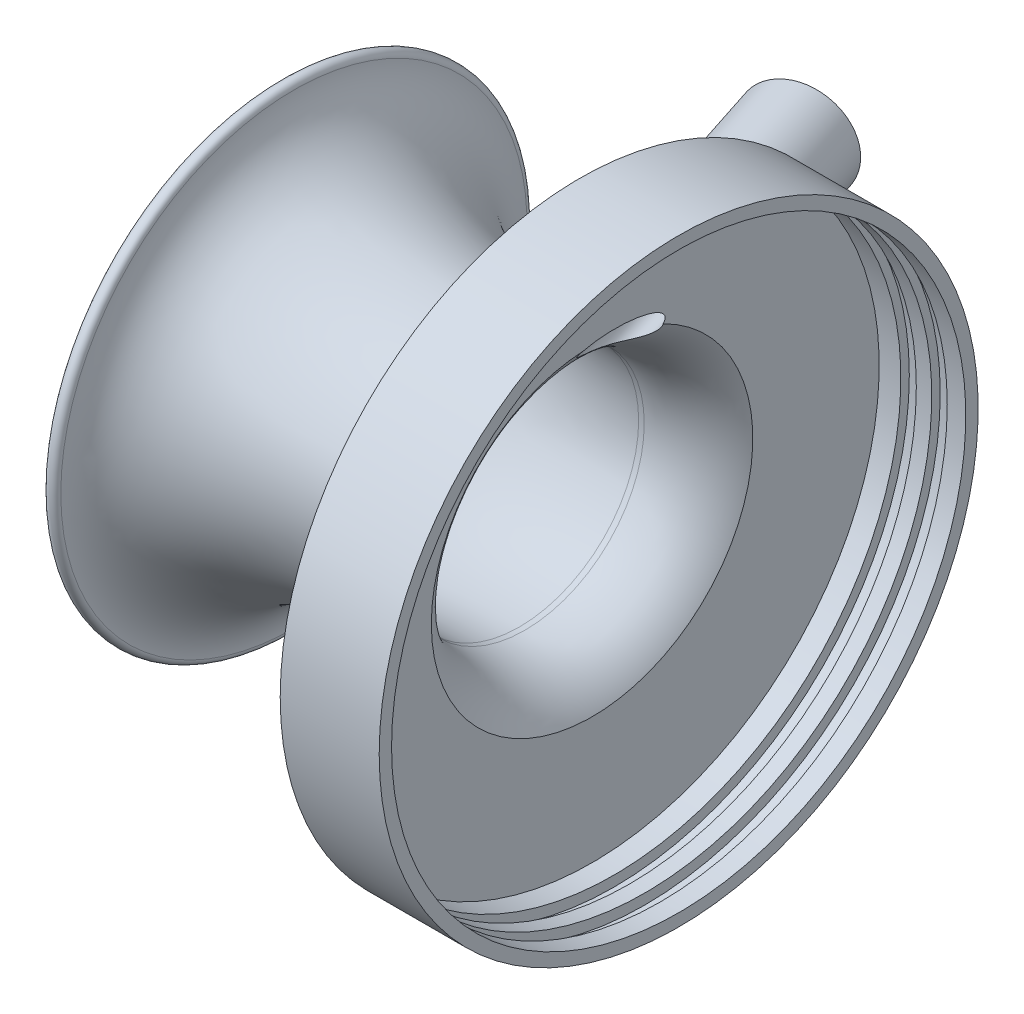
from build123d import *

# Parameters (mm, degrees)
BOSS_EXTRUDE1_REACH      = 139.829
SKETCH2_R                = 5.55625
SKETCH2_R_2              = 3.175
CUT_EXTRUDE1_DEPTH       = 138.828883705
CUT_EXTRUDE1_DEPTH_BACK  = 40.64
SKETCH2_3_R              = 3.175
BOSS_EXTRUDE3_DEPTH      = 25.4
BOSS_EXTRUDE3_DEPTH_BACK = 1.016
SKETCH2_4_R              = 10.16
SKETCH2_4_R_2            = 5.55625
SKETCH5_W                = 3.175
SKETCH5_H                = 2.8575


with BuildPart() as part:
    # Sketch1 → Revolve1 (revolve)
    with BuildSketch(Plane.XY):
        with BuildLine():
            Line((-17.78, 33.403326565), (-17.78, 59.350315565))
            Line((-17.78, 59.350315565), (0, 59.350315565))
            Line((0, 59.350315565), (0, 61.890315565))
            Line((0, 61.890315565), (-20.32, 61.890315565))
            Line((-20.32, 61.890315565), (-20.32, 34.112189466))
            ThreePointArc((-20.32, 34.112189466), (-25.197957931, 29.414317146), (-31.679989745, 27.452751069))
            Line((-31.679989745, 27.452751069), (-32.754114376, 27.428278778))
            add(Edge.make_bspline(
                [(-78.988210727, 48.263572049), (-78.974524565, 47.626969942), (-78.824846785, 46.370836181), (-78.021439697, 43.826156415), (-76.008698515, 40.601424178), (-71.876977344, 36.845746737), (-66.141964212, 33.481114548), (-59.042953877, 30.715957567), (-50.877199882, 28.700991702), (-42.001696553, 27.535499073), (-35.814640326, 27.362481236), (-32.754114376, 27.428278778)],
                knots=[3.141592654, 3.141592654, 3.141592654, 3.141592654, 3.239767424, 3.337942194, 3.534291735, 3.730641276, 3.926990817, 4.123340358, 4.319689899, 4.51603944, 4.71238898, 4.71238898, 4.71238898, 4.71238898], degree=3))
            ThreePointArc((-78.988210727, 48.263572049), (-80.285214463, 49.505981526), (-81.52762394, 48.20897779))
            add(Edge.make_bspline(
                [(-81.52762394, 48.20897779), (-81.003944056, 23.850379885), (-32.699520116, 24.888865565)],
                knots=[3.141592654, 3.141592654, 3.141592654, 4.71238898, 4.71238898, 4.71238898], degree=2, weights=[1, 0.707106781, 1]))
            Line((-32.699520116, 24.888865565), (-31.579850242, 24.914373358))
            ThreePointArc((-31.579850242, 24.914373358), (-23.60359817, 27.409146509), (-17.78, 33.403326565))
        make_face()
    revolve(axis=Axis((-34.322208184, 0.403265565, 0), (1, 0, 0)))


with BuildPart() as body_2:

    # Sketch2 → Boss-Extrude1 (new, up to next)
    with BuildSketch(Plane(origin=(-13.343353817, 0, -41.066620374), x_dir=(0, -1, 0), z_dir=(-0.3090169943749514, 0, -0.9510565162951523)), mode=Mode.PRIVATE) as boss_extrude1_sk1:
        with Locations((-30.889259617, 15.45046582)):
            Circle(SKETCH2_R)
        with Locations((-30.889259617, 15.45046582)):
            Circle(SKETCH2_R_2, mode=Mode.SUBTRACT)
    boss_extrude1_tool1 = extrude(boss_extrude1_sk1.sketch, amount=-BOSS_EXTRUDE1_REACH, mode=Mode.PRIVATE) - part.part
    add(boss_extrude1_tool1.solids().sort_by_distance((-28.03762, 36.288355, -36.292164))[0])


with BuildPart() as part_1:
    add(part.part)

    # Sketch2<3> → Cut-Extrude1 (cut, two sides: drawn at the far end of the back side and taken through both)
    with BuildSketch(Plane(origin=(-13.343353817, 0, -41.066620374), x_dir=(0, -1, 0), z_dir=(-0.3090169943749514, 0, -0.9510565162951523)).offset(-CUT_EXTRUDE1_DEPTH_BACK)):
        with Locations((-30.889259617, 15.45046582)):
            Circle(SKETCH2_3_R)
    extrude(amount=CUT_EXTRUDE1_DEPTH + CUT_EXTRUDE1_DEPTH_BACK, mode=Mode.SUBTRACT)

    add(body_2.part)  # Boss-Extrude3 merges body 2
    # Sketch2<4> → Boss-Extrude3 (add, two sides: drawn at the far end of the back side and taken through both)
    with BuildSketch(Plane(origin=(-13.343353817, 0, -41.066620374), x_dir=(0, -1, 0), z_dir=(-0.3090169943749514, 0, -0.9510565162951523)).offset(-BOSS_EXTRUDE3_DEPTH_BACK)):
        with Locations((-30.889259617, 15.45046582)):
            Circle(SKETCH2_4_R)
        with Locations((-30.889259617, 15.45046582)):
            Circle(SKETCH2_4_R_2, mode=Mode.SUBTRACT)
    extrude(amount=BOSS_EXTRUDE3_DEPTH + BOSS_EXTRUDE3_DEPTH_BACK)

    # Sketch5 → Cut-Revolve2 (revolve, cut)
    with BuildSketch(Plane.XY):
        with Locations((-11.7475, 59.25506564)):
            Rectangle(SKETCH5_W, SKETCH5_H)
        with Locations((-5.3975, 59.25506564)):
            Rectangle(SKETCH5_W, SKETCH5_H)
    revolve(axis=Axis((0, 0, 0), (-1, 0, 0)), mode=Mode.SUBTRACT)


solid = part_1.part
